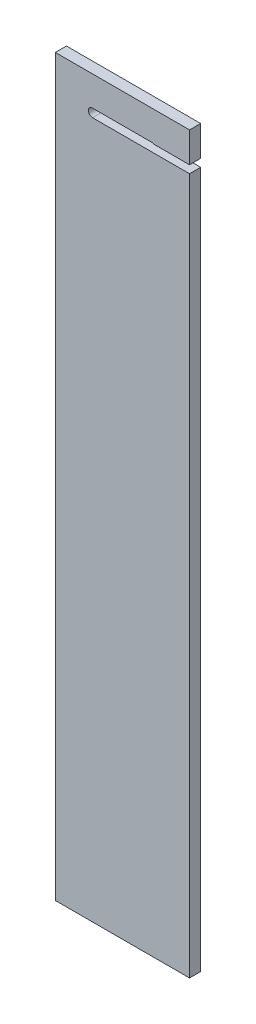
from build123d import *

# Parameters (mm, degrees)
BOSS_EXTRUDE1_DEPTH = 4.7625
FILLET1_R           = 3.175


with BuildPart() as part:
    # Sketch1 → Boss-Extrude1 (new body)
    with BuildSketch(Plane.XY):
        with BuildLine():
            Line((-28.75, 165.481), (-28.75, 149.225))
            Line((-28.75, 149.225), (-12.827, 149.225))
            ThreePointArc((-12.827, 149.225), (-14.605, 151.003), (-12.827, 152.781))
            Line((-12.827, 152.781), (12.827, 152.781))
            Line((12.827, 152.781), (12.827, 152.527))
            Line((12.827, 152.527), (28.75, 152.527))
            Line((28.75, 152.527), (28.75, 165.481))
            Line((28.75, 165.481), (-28.75, 165.481))
        make_face()
        Polygon((-12.827, 149.225), (-28.75, 149.225), (-28.75, -149.225), (28.75, -149.225), (28.75, 149.225), align=None)
    extrude(amount=BOSS_EXTRUDE1_DEPTH)

    # Fillet1
    # the kernel refuses this fillet: 3.175 mm, written as the material it takes off along each edge
    with BuildSketch(Plane(origin=(12.827, 152.527, -3.110851973), x_dir=(1, 0, 0), z_dir=(0, 0, 1))) as fillet1_piece_1:
        with BuildLine():
            CenterArc((1.244340789, 3.175), FILLET1_R, 246.926081934, 23.073918066)
            Line((0, 0.254), (-0.024886816, 0.19558))
            ThreePointArc((-0.024886816, 0.19558), (-0.0635, 0.127), (-0.0635, 0))
            Line((-0.0635, 0), (0, -0.0635))
            Line((0, -0.0635), (1.244340789, -0.0635))
            Line((1.244340789, -0.0635), (1.244340789, 0))
        make_face()
    extrude(amount=10.984203947, mode=Mode.SUBTRACT)


solid = part.part
